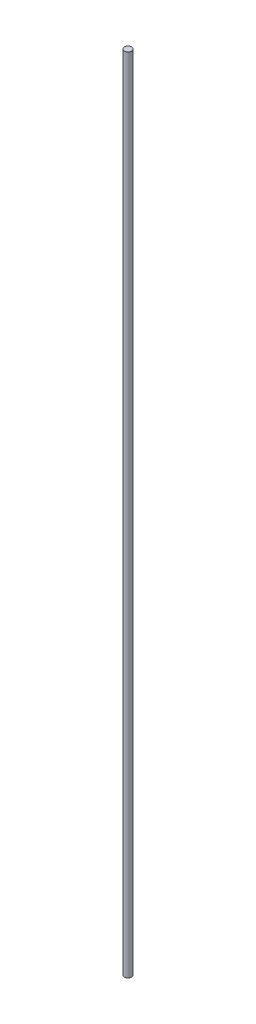
from build123d import *

# Parameters (mm, degrees)
SKETCH_2_W = 2.5
SKETCH_2_H = 544


with BuildPart() as part:
    # Эскиз2 → Повернуть1 (revolve)
    with BuildSketch(Plane.XY):
        with Locations((-1.25, 0)):
            Rectangle(SKETCH_2_W, SKETCH_2_H)
    revolve(axis=Axis((-2.5, 272, 0), (0, -1, 0)))


solid = part.part
